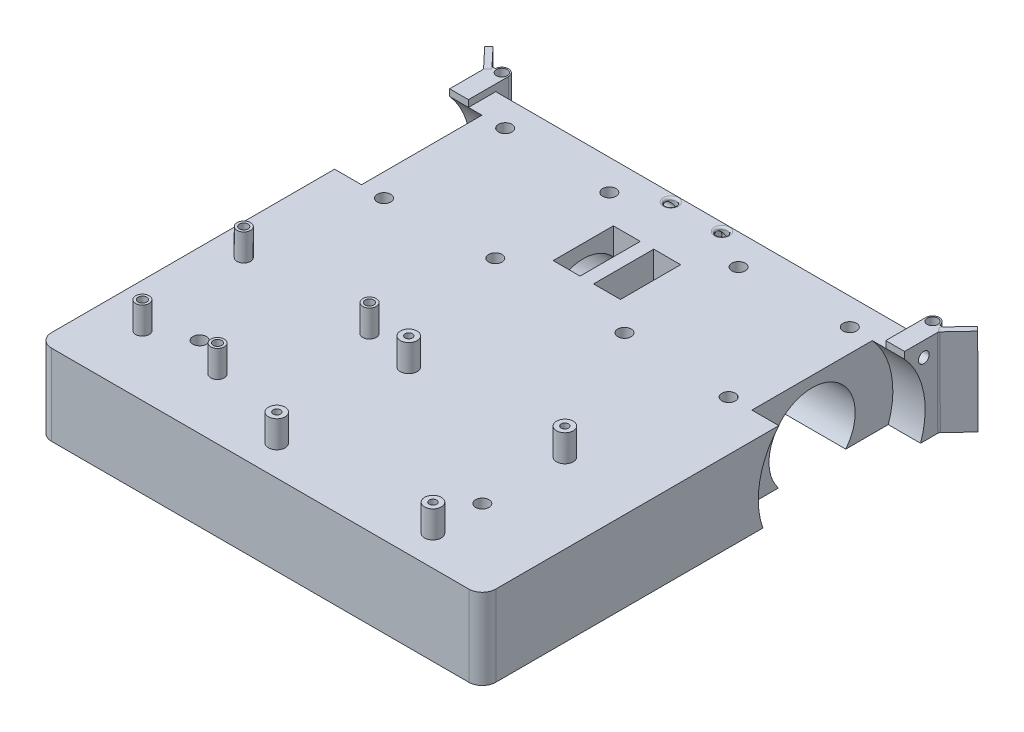
from build123d import *
from build123d.topology import SkipClean

# Parameters (mm, degrees)
ESQUISSE2_W             = 165
ESQUISSE2_H             = 165
BASE_DEPTH              = 30
ESQUISSE3_R             = 15
BLOC_MOTEUR_1_DEPTH     = 80
ESQUISSE4_W             = 10
ESQUISSE4_H             = 22.360679774
ACCES_MOTEUR_DEPTH      = 37
ESQUISSE6_R             = 16.01
BLOC_MOTEUR_2_DEPTH     = 37
ESQUISSE7_R             = 2.5
VIS_MOTEUR_DEPTH        = 121.467838032
ESQUISSE8_R             = 2.5
VIS_PATIN_DEPTH         = 121.467838032
ESQUISSE9_R             = 3.1
ESQUISSE9_R_2           = 1.375
SUPPORT_RASP_DEPTH      = 10
ESQUISSE11_R            = 2.5
ESQUISSE11_R_2          = 1.6
SUPPORT_ARDUINO_DEPTH   = 10
CONGE_EXT_R             = 5
ESQUISSE12_R            = 30
ESPACE_ROUE_DEPTH       = 10
FIXE_PORTE_1_DEPTH      = 2.5
FIXE_PORTE_1_DEPTH_BACK = 10
ESQUISSE14_R            = 2
ESQUISSE15_W            = 5
ESQUISSE15_H            = 10.139320225
FIXE_PORTE_2_DEPTH      = 2.5
ESQUISSE16_R            = 2
FIXE_PORTE_3_DEPTH      = 10
ESQUISSE18_R            = 2
VIDE_CORDE_COTE_DEPTH   = 75
ESQUISSE19_R            = 2
VIDEO_CORDE_HAUT_DEPTH  = 5
CONGE_CORDE_R           = 0.8
ESQUISSE20_R            = 2
BOSS_MAX_PORTE_DEPTH    = 2
BOSS_START              = -0.5
BOSS_PORTE_45_DEPTH     = 10.5
CONGE_PORTE_45_R        = 1


with BuildPart() as part:
    # Esquisse2 → BASE (new body)
    with BuildSketch(Plane(origin=(0, 0, 0), x_dir=(1, 0, 0), z_dir=(0, 1, 0))):
        Rectangle(ESQUISSE2_W, ESQUISSE2_H)
    extrude(amount=BASE_DEPTH)

    # Esquisse3 → BLOC MOTEUR 1. (cut)
    with BuildSketch(Plane(origin=(82.5, 0, 0), x_dir=(0, 0, -1), z_dir=(1, 0, 0))):
        with Locations((50, 10)):
            Circle(ESQUISSE3_R)
    bloc_moteur_1 = extrude(amount=-BLOC_MOTEUR_1_DEPTH, mode=Mode.SUBTRACT)

    # Esquisse4 → ACCES MOTEUR (cut)
    with BuildSketch(Plane.XZ):
        with Locations((7.5, -50)):
            Rectangle(ESQUISSE4_W, ESQUISSE4_H)
    acces_moteur = extrude(amount=-ACCES_MOTEUR_DEPTH, mode=Mode.SUBTRACT)

    # Esquisse6 → BLOC MOTEUR 2 (cut)
    with BuildSketch(Plane(origin=(82.5, 0, 0), x_dir=(0, 0, -1), z_dir=(1, 0, 0))):
        with Locations((50, 10)):
            Circle(ESQUISSE6_R)
    bloc_moteur_2 = extrude(amount=-BLOC_MOTEUR_2_DEPTH, mode=Mode.SUBTRACT)

    # SYM BLOC MOTEUR: BLOC MOTEUR 1., ACCES MOTEUR, BLOC MOTEUR 2 across plane
    add(bloc_moteur_1.mirror(Plane(origin=(0, 0, 0), x_dir=(0, 0, 1), z_dir=(1, 0, 0))), mode=Mode.SUBTRACT)
    add(acces_moteur.mirror(Plane(origin=(0, 0, 0), x_dir=(0, 0, 1), z_dir=(1, 0, 0))), mode=Mode.SUBTRACT)
    add(bloc_moteur_2.mirror(Plane(origin=(0, 0, 0), x_dir=(0, 0, 1), z_dir=(1, 0, 0))), mode=Mode.SUBTRACT)

    # Esquisse7 → VIS MOTEUR (cut, through all)
    with BuildSketch(Plane.XZ):
        with Locations(Location((-64, -27.497196314, 0), (0, 0, 270))):
            Circle(ESQUISSE7_R)
        with Locations(Location((-24, -28.819660113, 0), (0, 0, 270))):
            Circle(ESQUISSE7_R)
        with Locations(Location((-24, -71.180339887, 0), (0, 0, 270))):
            Circle(ESQUISSE7_R)
        with Locations(Location((-64, -72.502803686, 0), (0, 0, 270))):
            Circle(ESQUISSE7_R)
    vis_moteur = extrude(amount=-VIS_MOTEUR_DEPTH, mode=Mode.SUBTRACT)

    # SYM VIS: VIS MOTEUR across plane
    add(vis_moteur.mirror(Plane(origin=(0, 0, 0), x_dir=(0, 0, 1), z_dir=(1, 0, 0))), mode=Mode.SUBTRACT)

    # Esquisse8 → VIS PATIN (cut, through all)
    with BuildSketch(Plane.XZ):
        with Locations(Location((-52.5, 52.5, 0), (0, 0, 270))):
            Circle(ESQUISSE8_R)
        with Locations(Location((52.5, 52.5, 0), (0, 0, 270))):
            Circle(ESQUISSE8_R)
    extrude(amount=-VIS_PATIN_DEPTH, mode=Mode.SUBTRACT)

    # Esquisse9 → SUPPORT RASP (add)
    # profile 1 of 4: a face of its own
    with BuildSketch(Plane(origin=(0, 30, 0), x_dir=(1, 0, 0), z_dir=(0, 1, 0))):
        with Locations(Location((-5.124679211, -22.194338496, 0), (0, 0, 90))):
            Circle(ESQUISSE9_R)
        with Locations(Location((-5.124679211, -22.194338496, 0), (0, 0, 270))):
            Circle(ESQUISSE9_R_2, mode=Mode.SUBTRACT)
    # profile 2 of 4: a face of its own
    with BuildSketch(Plane(origin=(0, 30, 0), x_dir=(1, 0, 0), z_dir=(0, 1, 0))):
        with Locations(Location((52.875320789, -22.194338496, 0), (0, 0, 90))):
            Circle(ESQUISSE9_R)
        with Locations(Location((52.875320789, -22.194338496, 0), (0, 0, 270))):
            Circle(ESQUISSE9_R_2, mode=Mode.SUBTRACT)
    # profile 3 of 4: a face of its own
    with BuildSketch(Plane(origin=(0, 30, 0), x_dir=(1, 0, 0), z_dir=(0, 1, 0))):
        with Locations(Location((-5.124679211, -71.194338496, 0), (0, 0, 90))):
            Circle(ESQUISSE9_R)
        with Locations(Location((-5.124679211, -71.194338496, 0), (0, 0, 270))):
            Circle(ESQUISSE9_R_2, mode=Mode.SUBTRACT)
    # profile 4 of 4: a face of its own
    with BuildSketch(Plane(origin=(0, 30, 0), x_dir=(1, 0, 0), z_dir=(0, 1, 0))):
        with Locations(Location((52.875320789, -71.194338496, 0), (0, 0, 90))):
            Circle(ESQUISSE9_R)
        with Locations(Location((52.875320789, -71.194338496, 0), (0, 0, 270))):
            Circle(ESQUISSE9_R_2, mode=Mode.SUBTRACT)
    extrude(amount=SUPPORT_RASP_DEPTH)

    # Esquisse11 → SUPPORT ARDUINO (add)
    # profile 1 of 4: a face of its own
    with BuildSketch(Plane(origin=(0, 30, 0), x_dir=(1, 0, 0), z_dir=(0, 1, 0))):
        with Locations(Location((-70.933772323, -17.670594659, 0), (0, 0, 90))):
            Circle(ESQUISSE11_R)
        with Locations(Location((-70.933772323, -17.670594659, 0), (0, 0, 270))):
            Circle(ESQUISSE11_R_2, mode=Mode.SUBTRACT)
    # profile 2 of 4: a face of its own
    with BuildSketch(Plane(origin=(0, 30, 0), x_dir=(1, 0, 0), z_dir=(0, 1, 0))):
        with Locations(Location((-23.123772323, -18.770594659, 0), (0, 0, 90))):
            Circle(ESQUISSE11_R)
        with Locations(Location((-23.123772323, -18.770594659, 0), (0, 0, 270))):
            Circle(ESQUISSE11_R_2, mode=Mode.SUBTRACT)
    # profile 3 of 4: a face of its own
    with BuildSketch(Plane(origin=(0, 30, 0), x_dir=(1, 0, 0), z_dir=(0, 1, 0))):
        with Locations(Location((-66.233772323, -60.010594659, 0), (0, 0, 90))):
            Circle(ESQUISSE11_R)
        with Locations(Location((-66.233772323, -60.010594659, 0), (0, 0, 270))):
            Circle(ESQUISSE11_R_2, mode=Mode.SUBTRACT)
    # profile 4 of 4: a face of its own
    with BuildSketch(Plane(origin=(0, 30, 0), x_dir=(1, 0, 0), z_dir=(0, 1, 0))):
        with Locations(Location((-38.333772323, -60.010594659, 0), (0, 0, 90))):
            Circle(ESQUISSE11_R)
        with Locations(Location((-38.333772323, -60.010594659, 0), (0, 0, 270))):
            Circle(ESQUISSE11_R_2, mode=Mode.SUBTRACT)
    extrude(amount=SUPPORT_ARDUINO_DEPTH)

    # CONGE EXT
    conge_ext_edges = [part.edges().sort_by_distance(p)[0] for p in [
        (82.5, 15, 82.5),
        (-82.5, 15, 82.5),
    ]]
    fillet(conge_ext_edges, radius=CONGE_EXT_R)

    # Esquisse12 → ESPACE ROUE (cut)
    with BuildSketch(Plane.ZY.offset(82.5)):
        with Locations((-50, 10)):
            Circle(ESQUISSE12_R)
    espace_roue = extrude(amount=-ESPACE_ROUE_DEPTH, mode=Mode.SUBTRACT)

    # SYM ESPACE ROUE: ESPACE ROUE across plane
    add(espace_roue.mirror(Plane(origin=(0, 0, 0), x_dir=(0, 0, 1), z_dir=(1, 0, 0))), mode=Mode.SUBTRACT)

    # Esquisse14 → FIXE PORTE 1 (add, two sides: drawn at the far end of the back side and taken through both)
    # profile 1 of 2: a face of its own
    with BuildSketch(Plane(origin=(0, 30, 0), x_dir=(1, 0, 0), z_dir=(0, 1, 0)).offset(-FIXE_PORTE_1_DEPTH_BACK)):
        with BuildLine():
            ThreePointArc((-77.5, 87.245138583), (-80, 89.745138583), (-82.5, 87.245138583))
            Line((-82.5, 87.245138583), (-82.5, 82.5))
            Line((-82.5, 82.5), (-77.5, 82.5))
            Line((-77.5, 82.5), (-77.5, 87.245138583))
        make_face()
        with Locations(Location((-80, 87.245138583, 0), (0, 0, 270))):
            Circle(ESQUISSE14_R, mode=Mode.SUBTRACT)
    # profile 2 of 2: a face of its own
    with BuildSketch(Plane(origin=(0, 30, 0), x_dir=(1, 0, 0), z_dir=(0, 1, 0)).offset(-FIXE_PORTE_1_DEPTH_BACK)):
        with BuildLine():
            Line((77.5, 87.245138583), (77.5, 82.5))
            Line((77.5, 82.5), (82.5, 82.5))
            Line((82.5, 82.5), (82.5, 87.245138583))
            ThreePointArc((82.5, 87.245138583), (80, 89.745138583), (77.5, 87.245138583))
        make_face()
        with Locations(Location((80, 87.245138583, 0), (0, 0, 270))):
            Circle(ESQUISSE14_R, mode=Mode.SUBTRACT)
    extrude(amount=FIXE_PORTE_1_DEPTH + FIXE_PORTE_1_DEPTH_BACK)

    # Esquisse15 → FIXE PORTE 2 (add)
    with BuildSketch(Plane(origin=(0, 30, 0), x_dir=(1, 0, 0), z_dir=(0, 1, 0))):
        with Locations((-80, 77.430339887)):
            Rectangle(ESQUISSE15_W, ESQUISSE15_H)
        with Locations((80, 77.430339887)):
            Rectangle(ESQUISSE15_W, ESQUISSE15_H)
    extrude(amount=FIXE_PORTE_2_DEPTH)

    # Esquisse16 → FIXE PORTE 3 (add)
    # profile 1 of 2: a face of its own
    with BuildSketch(Plane.XZ):
        with BuildLine():
            Line((-82.5, -82.5), (-82.5, -87.245138583))
            ThreePointArc((-82.5, -87.245138583), (-80, -89.745138583), (-77.5, -87.245138583))
            Line((-77.5, -87.245138583), (-77.5, -82.5))
            Line((-77.5, -82.5), (-82.5, -82.5))
        make_face()
        with Locations(Location((-80, -87.245138583, 0), (0, 0, 90))):
            Circle(ESQUISSE16_R, mode=Mode.SUBTRACT)
    # profile 2 of 2: a face of its own
    with BuildSketch(Plane.XZ):
        with BuildLine():
            Line((82.5, -82.5), (77.5, -82.5))
            Line((77.5, -82.5), (77.5, -87.245138583))
            ThreePointArc((77.5, -87.245138583), (80, -89.745138583), (82.5, -87.245138583))
            Line((82.5, -87.245138583), (82.5, -82.5))
        make_face()
        with Locations(Location((80, -87.245138583, 0), (0, 0, 90))):
            Circle(ESQUISSE16_R, mode=Mode.SUBTRACT)
    extrude(amount=-FIXE_PORTE_3_DEPTH)

    # Esquisse18 → VIDE CORDE COTE (cut)
    with BuildSketch(Plane(origin=(82.5, 0, 0), x_dir=(0, 0, -1), z_dir=(1, 0, 0))):
        with Locations((79.5, 27)):
            Circle(ESQUISSE18_R)
    vide_corde_cote = extrude(amount=-VIDE_CORDE_COTE_DEPTH, mode=Mode.SUBTRACT)

    # Esquisse19 → VIDEO CORDE HAUT (cut)
    with BuildSketch(Plane(origin=(0, 30, 0), x_dir=(1, 0, 0), z_dir=(0, 1, 0))):
        with Locations(Location((9.5, 79.5, 0), (0, 0, 270))):
            Circle(ESQUISSE19_R)
    video_corde_haut = extrude(amount=-VIDEO_CORDE_HAUT_DEPTH, mode=Mode.SUBTRACT)

    # SYM CORDE: VIDE CORDE COTE, VIDEO CORDE HAUT across plane
    add(vide_corde_cote.mirror(Plane(origin=(0, 0, 0), x_dir=(0, 0, 1), z_dir=(1, 0, 0))), mode=Mode.SUBTRACT)
    add(video_corde_haut.mirror(Plane(origin=(0, 0, 0), x_dir=(0, 0, 1), z_dir=(1, 0, 0))), mode=Mode.SUBTRACT)

    # CONGE CORDE
    conge_corde_edges = [part.edges().sort_by_distance(p)[0] for p in [
        (9.5, 30, -81.5),
        (-9.5, 30, -81.5),
    ]]
    fillet(conge_corde_edges, radius=CONGE_CORDE_R)

    # Esquisse20 → BOSS MAX PORTE (add)
    with SkipClean():  # the faces are left unmerged after this step: merging them gives an invalid solid
        with BuildSketch(Plane(origin=(82.5, 0, 0), x_dir=(0, 0, -1), z_dir=(1, 0, 0))):
            with BuildLine():
                Line((72.360679775, 30), (72.360679775, 32.5))
                Line((72.360679775, 32.5), (87.360679775, 32.5))
                Line((87.360679775, 32.5), (87.360679775, 0))
                Line((87.360679775, 0), (78.284271247, 0))
                ThreePointArc((78.284271247, 0), (79.431747587, 15.811388301), (72.360679775, 30))
            make_face()
            with Locations((79.5, 27)):
                Circle(ESQUISSE20_R, mode=Mode.SUBTRACT)
        boss_max_porte = extrude(amount=BOSS_MAX_PORTE_DEPTH)

    # SYM MAX PORTE: BOSS MAX PORTE across plane
    with SkipClean():  # the faces are left unmerged after this step: merging them gives an invalid solid
        add(boss_max_porte.mirror(Plane(origin=(0, 0, 0), x_dir=(0, 0, 1), z_dir=(1, 0, 0))))

    # Esquisse22 → BOSS PORTE 45 (add)
    with SkipClean():  # the faces are left unmerged after this step: merging them gives an invalid solid
        with BuildSketch(Plane(origin=(82.400815449, 0.310905454, -87.453029071), x_dir=(-0.7278195737700707, 0.0024379701221012664, -0.6857643358609695), z_dir=(0.6857686694776547, 0.0025874649194508412, -0.7278149744187309)).offset(BOSS_START)):
            Polygon((-1.591915437, -0.310575179), (-0.969834451, -0.310575179), (-0.969834451, 32.19171029), (-3.159582394, 32.19775719), (-3.159582394, -0.30244819), align=None)
        boss_porte_45 = extrude(amount=BOSS_PORTE_45_DEPTH)

    # SYM MAX PORTE 45: BOSS PORTE 45 across plane
    with SkipClean():  # the faces are left unmerged after this step: merging them gives an invalid solid
        add(boss_porte_45.mirror(Plane(origin=(0, 0, 0), x_dir=(0, 0, 1), z_dir=(1, 0, 0))))

    # CONGE PORTE 45
    # the kernel refuses this fillet: 1 mm, written as the material it adds along each edge
    with BuildSketch(Plane(origin=(84.5, 33.492239506, -84.955596936), x_dir=(0, -0.0035550911416795607, 0.99999368064352), z_dir=(0, -0.9999936806435201, -0.003555091141679561))) as conge_porte_45_piece_1_section:
        with BuildLine():
            CenterArc((CONGE_PORTE_45_R * 0.396898310384, -CONGE_PORTE_45_R), CONGE_PORTE_45_R, 90, 43.296088669)
            Line((-CONGE_PORTE_45_R * 0.288870359094, -CONGE_PORTE_45_R * 0.27218042623), (0, 0))
            Line((0, 0), (CONGE_PORTE_45_R * 0.396898310384, 0))
        make_face()
    conge_porte_45_piece_1 = extrude(amount=34.484696932, mode=Mode.PRIVATE)
    conge_porte_45_piece_1 = split(conge_porte_45_piece_1, bisect_by=Plane(origin=(84.651606735, 32.5, -85.118504897), z_dir=(0, 1, 0)), keep=Keep.TOP, mode=Mode.PRIVATE)
    conge_porte_45_piece_1 = split(conge_porte_45_piece_1, bisect_by=Plane(origin=(84.651606162, 32.500569495, -85.118504424), z_dir=(0.002009836443436163, -0.9999966001902965, -0.001661374527015314)), keep=Keep.TOP, mode=Mode.PRIVATE)
    add(conge_porte_45_piece_1)
    with BuildSketch(Plane(origin=(84.5, 33.492239506, -84.955596936), x_dir=(0, -0.0035550911416795607, 0.99999368064352), z_dir=(0, -0.9999936806435201, -0.003555091141679561))) as conge_porte_45_piece_2_section:
        with BuildLine():
            CenterArc((CONGE_PORTE_45_R * 0.396898310384, -CONGE_PORTE_45_R), CONGE_PORTE_45_R, 90, 43.296088669)
            Line((-CONGE_PORTE_45_R * 0.288870359094, -CONGE_PORTE_45_R * 0.27218042623), (0, 0))
            Line((0, 0), (CONGE_PORTE_45_R * 0.396898310384, 0))
        make_face()
    conge_porte_45_piece_2 = extrude(amount=34.484696932, mode=Mode.PRIVATE)
    conge_porte_45_piece_2 = split(conge_porte_45_piece_2, bisect_by=Plane(origin=(84.497035788, 32.5, -84.725812597), z_dir=(0, -1, 0)), keep=Keep.TOP, mode=Mode.PRIVATE)
    conge_porte_45_piece_2 = split(conge_porte_45_piece_2, bisect_by=Plane(origin=(84.497036184, 32.499606424, -84.725812924), z_dir=(-0.002009836443436163, 0.9999966001902965, 0.001661374527015314)), keep=Keep.TOP, mode=Mode.PRIVATE)
    add(conge_porte_45_piece_2)
    with BuildSketch(Plane(origin=(84.5, 33.492239506, -84.955596936), x_dir=(0, -0.0035550911416795607, 0.99999368064352), z_dir=(0, -0.9999936806435201, -0.003555091141679561))) as conge_porte_45_piece_3_section:
        with BuildLine():
            CenterArc((CONGE_PORTE_45_R * 0.396898310384, -CONGE_PORTE_45_R), CONGE_PORTE_45_R, 90, 43.296088669)
            Line((-CONGE_PORTE_45_R * 0.288870359094, -CONGE_PORTE_45_R * 0.27218042623), (0, 0))
            Line((0, 0), (CONGE_PORTE_45_R * 0.396898310384, 0))
        make_face()
    conge_porte_45_piece_3 = extrude(amount=34.484696932, mode=Mode.PRIVATE)
    conge_porte_45_piece_3 = split(conge_porte_45_piece_3, bisect_by=Plane(origin=(84.618432305, 0.000446855, -84.994223029), z_dir=(-0.0037730602417317648, 0.9999928819828732, 0)), keep=Keep.TOP, mode=Mode.PRIVATE)
    conge_porte_45_piece_3 = split(conge_porte_45_piece_3, bisect_by=Plane(origin=(84.524461153, 32.500062622, -84.967225586), z_dir=(0.002009836443436163, -0.9999966001902965, -0.001661374527015314)), keep=Keep.TOP, mode=Mode.PRIVATE)
    add(conge_porte_45_piece_3)
    with BuildSketch(Plane(origin=(-84.5, -0.992239506, -85.078193176), x_dir=(0, -0.003555091141679562, 0.99999368064352), z_dir=(0, 0.9999936806435201, 0.003555091141679562))) as conge_porte_45_piece_4_section:
        with BuildLine():
            CenterArc((CONGE_PORTE_45_R * 0.396898310384, -CONGE_PORTE_45_R), CONGE_PORTE_45_R, 90, 43.296088669)
            Line((-CONGE_PORTE_45_R * 0.288870359094, -CONGE_PORTE_45_R * 0.27218042623), (0, 0))
            Line((0, 0), (CONGE_PORTE_45_R * 0.396898310384, 0))
        make_face()
    conge_porte_45_piece_4 = extrude(amount=34.484696932, mode=Mode.PRIVATE)
    conge_porte_45_piece_4 = split(conge_porte_45_piece_4, bisect_by=Plane(origin=(-84.618432305, 0.000446855, -84.994223029), z_dir=(0.0037730602417317648, 0.9999928819828732, 0)), keep=Keep.TOP, mode=Mode.PRIVATE)
    conge_porte_45_piece_4 = split(conge_porte_45_piece_4, bisect_by=Plane(origin=(-84.524461153, 32.500062622, -84.967225586), z_dir=(-0.0020098364434361633, -0.9999966001902966, -0.0016613745270153137)), keep=Keep.TOP, mode=Mode.PRIVATE)
    add(conge_porte_45_piece_4)
    with BuildSketch(Plane(origin=(-84.5, -0.992239506, -85.078193176), x_dir=(0, -0.003555091141679562, 0.99999368064352), z_dir=(0, 0.9999936806435201, 0.003555091141679562))) as conge_porte_45_piece_5_section:
        with BuildLine():
            CenterArc((CONGE_PORTE_45_R * 0.396898310384, -CONGE_PORTE_45_R), CONGE_PORTE_45_R, 90, 43.296088669)
            Line((-CONGE_PORTE_45_R * 0.288870359094, -CONGE_PORTE_45_R * 0.27218042623), (0, 0))
            Line((0, 0), (CONGE_PORTE_45_R * 0.396898310384, 0))
        make_face()
    conge_porte_45_piece_5 = extrude(amount=34.484696932, mode=Mode.PRIVATE)
    conge_porte_45_piece_5 = split(conge_porte_45_piece_5, bisect_by=Plane(origin=(-84.651606735, 32.5, -85.118504897), z_dir=(0, 1, 0)), keep=Keep.TOP, mode=Mode.PRIVATE)
    conge_porte_45_piece_5 = split(conge_porte_45_piece_5, bisect_by=Plane(origin=(-84.651606162, 32.500569495, -85.118504424), z_dir=(-0.0020098364434361633, -0.9999966001902966, -0.0016613745270153137)), keep=Keep.TOP, mode=Mode.PRIVATE)
    add(conge_porte_45_piece_5)
    with BuildSketch(Plane(origin=(-84.5, -0.992239506, -85.078193176), x_dir=(0, -0.003555091141679562, 0.99999368064352), z_dir=(0, 0.9999936806435201, 0.003555091141679562))) as conge_porte_45_piece_6_section:
        with BuildLine():
            CenterArc((CONGE_PORTE_45_R * 0.396898310384, -CONGE_PORTE_45_R), CONGE_PORTE_45_R, 90, 43.296088669)
            Line((-CONGE_PORTE_45_R * 0.288870359094, -CONGE_PORTE_45_R * 0.27218042623), (0, 0))
            Line((0, 0), (CONGE_PORTE_45_R * 0.396898310384, 0))
        make_face()
    conge_porte_45_piece_6 = extrude(amount=34.484696932, mode=Mode.PRIVATE)
    conge_porte_45_piece_6 = split(conge_porte_45_piece_6, bisect_by=Plane(origin=(-84.497035788, 32.5, -84.725812597), z_dir=(0, -1, 0)), keep=Keep.TOP, mode=Mode.PRIVATE)
    conge_porte_45_piece_6 = split(conge_porte_45_piece_6, bisect_by=Plane(origin=(-84.497036184, 32.499606424, -84.725812924), z_dir=(0.0020098364434361633, 0.9999966001902966, 0.0016613745270153137)), keep=Keep.TOP, mode=Mode.PRIVATE)
    add(conge_porte_45_piece_6)


solid = part.part
